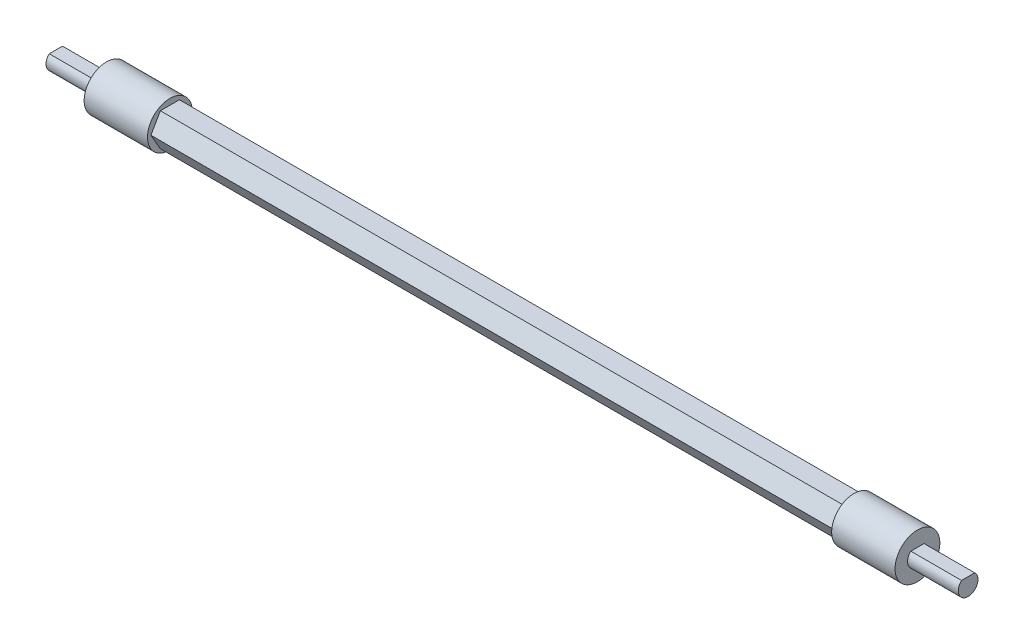
from build123d import *

# Parameters (mm, degrees)
BOSS_EXTRUDE1_DEPTH = 67.5
BOSS_EXTRUDE2_START = 67.5
SKETCH1_3_R         = 4.425
BOSS_EXTRUDE2_DEPTH = 12.5
BOSS_EXTRUDE4_DEPTH = 10


with BuildPart() as part:
    # Sketch1 → Boss-Extrude1 (new, symmetric)
    with BuildSketch(Plane(origin=(0, 0, 0), x_dir=(0, 0, -1), z_dir=(1, 0, 0))):
        Polygon((1.875, -3.247595264), (3.75, 0), (1.875, 3.247595264), (-1.875, 3.247595264), (-3.75, 0), (-1.875, -3.247595264), align=None)
    extrude(amount=BOSS_EXTRUDE1_DEPTH, both=True)

    # Sketch1<3> → Boss-Extrude2 (add)
    with BuildSketch(Plane(origin=(0, 0, 0), x_dir=(0, 0, -1), z_dir=(1, 0, 0)).offset(BOSS_EXTRUDE2_START)):
        Circle(SKETCH1_3_R)
    boss_extrude2 = extrude(amount=BOSS_EXTRUDE2_DEPTH)

    # Sketch4 → Boss-Extrude4 (add)
    with BuildSketch(Plane(origin=(80, 0, 0), x_dir=(0, 0, -1), z_dir=(1, 0, 0))):
        with BuildLine():
            Line((1.303840481, 1.45), (-1.303840481, 1.45))
            ThreePointArc((-1.303840481, 1.45), (-0.793728878, -1.78114976), (1.95, 0))
            ThreePointArc((1.95, 0), (1.78114976, 0.793728878), (1.303840481, 1.45))
        make_face()
    boss_extrude4 = extrude(amount=BOSS_EXTRUDE4_DEPTH)

    # Mirror2: Boss-Extrude2, Boss-Extrude4 across plane
    add(boss_extrude2.mirror(Plane(origin=(0, 0, 0), x_dir=(0, 0, 1), z_dir=(1, 0, 0))))
    add(boss_extrude4.mirror(Plane(origin=(0, 0, 0), x_dir=(0, 0, 1), z_dir=(1, 0, 0))))


solid = part.part
